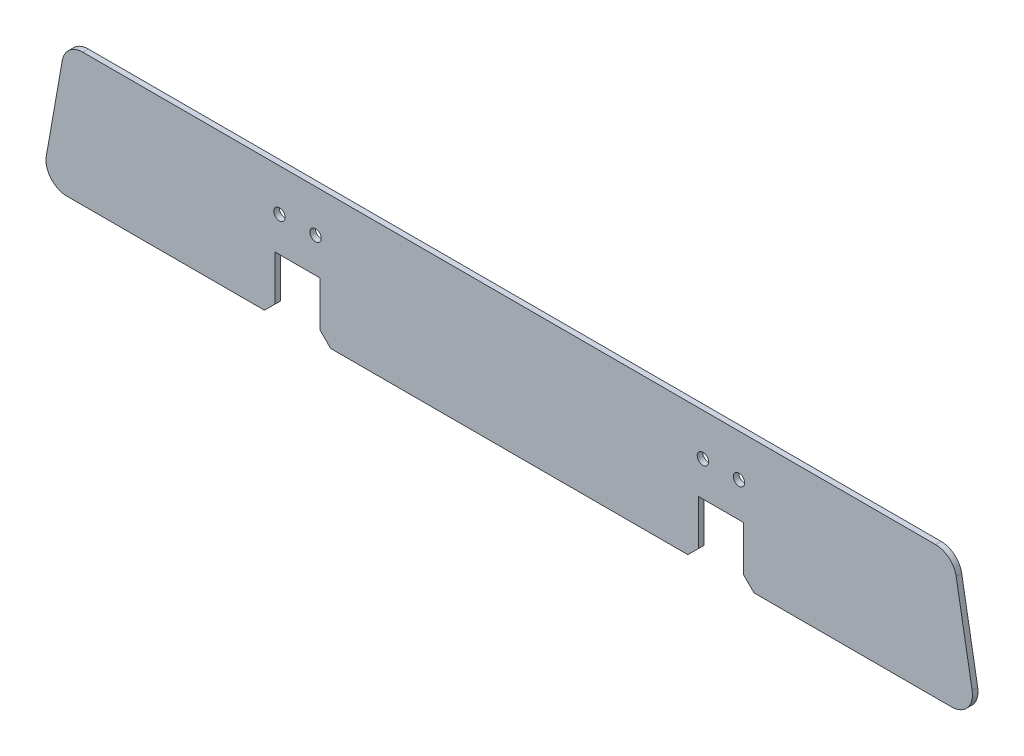
from build123d import *

# Parameters (mm, degrees)
SKETCH1_W               = 510
SKETCH1_H               = 76.2
BOSS_EXTRUDE1_DEPTH     = 3.175
SKETCH2_W               = 26
SKETCH2_H               = 32
CUT_EXTRUDE1_DEPTH      = 258.850132102
F_1_4_CLEARANCE_HOLE1_D = 6.5278
DRAFT1_ANGLE            = 10
FILLET1_R               = 12
CHAMFER1_SIZE           = 6


with BuildPart() as part:
    # Sketch1 → Boss-Extrude1 (new body)
    with BuildSketch(Plane.XY):
        Rectangle(SKETCH1_W, SKETCH1_H)
    extrude(amount=BOSS_EXTRUDE1_DEPTH)

    # Sketch2 → Cut-Extrude1 (cut, through all)
    with BuildSketch(Plane.XY.offset(3.175)):
        with Locations((121.62, -22.1)):
            Rectangle(SKETCH2_W, SKETCH2_H)
        with Locations((-121.62, -22.1)):
            Rectangle(SKETCH2_W, SKETCH2_H)
    extrude(amount=-CUT_EXTRUDE1_DEPTH, mode=Mode.SUBTRACT)

    # 1/4 Clearance Hole1 (through all)
    with Locations(Plane.XY.offset(3.175)):
        with Locations((-131.975, 13.9), (-111.265, 13.9), (111.265, 13.9), (131.975, 13.9)):
            Hole(F_1_4_CLEARANCE_HOLE1_D / 2)

    # Draft1
    draft1_faces = [part.faces().sort_by_distance(p)[0] for p in [
        (255, 0, 1.5875),
        (-255, 0, 1.5875),
    ]]
    draft(draft1_faces, Plane(origin=(255, 38.1, 3.175), x_dir=(1, 0, 0), z_dir=(0, 1, 0)), DRAFT1_ANGLE)

    # Fillet1
    fillet1_edges = [part.edges().sort_by_distance(p)[0] for p in [
        (-268.43611593, -38.1, 1.5875),
        (-255, 38.1, 1.5875),
        (255, 38.1, 1.5875),
        (268.43611593, -38.1, 1.5875),
    ]]
    fillet(fillet1_edges, radius=FILLET1_R)

    # Chamfer1
    chamfer1_edges = [part.edges().sort_by_distance(p)[0] for p in [
        (-134.62, -38.1, 1.5875),
        (134.62, -38.1, 1.5875),
        (108.62, -38.1, 1.5875),
        (-108.62, -38.1, 1.5875),
    ]]
    chamfer(chamfer1_edges, length=CHAMFER1_SIZE)


solid = part.part
